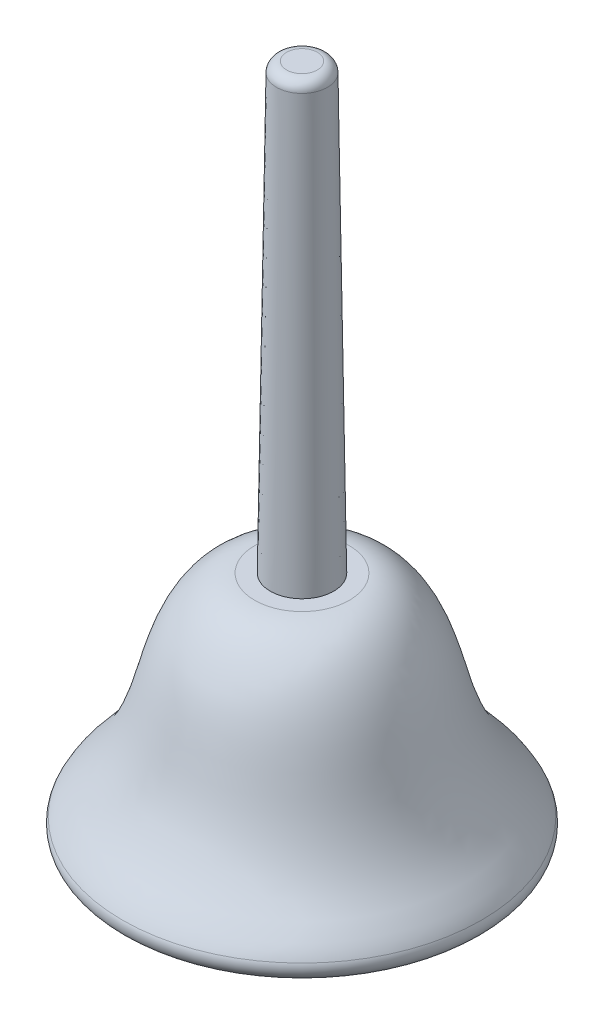
from build123d import *

# Parameters (mm, degrees)
FILLET2_R = 2.032
FILLET4_R = 1.27


with BuildPart() as part:
    # Sketch1 → Revolve3 (revolve)
    with BuildSketch(Plane.XY):
        with BuildLine():
            Line((0, 42.545), (0, 45.72))
            Line((0, 45.72), (-9.497287659, 45.72))
            add(Edge.make_bspline(
                [(-9.497287659, 45.72), (-14.213529728, 45.464495083), (-21.795325511, 37.1428909), (-24.067211816, 22.538590511), (-30.02752275, 9.539444124), (-36.734305824, 4.139328981), (-36.83, 0)],
                knots=[0, 0, 0, 0, 0.238527214, 0.556757743, 0.795415438, 1, 1, 1, 1], degree=3))
            Line((-36.83, 0), (-33.653639598, 0))
            add(Edge.make_bspline(
                [(-10.85999929, 42.277584205), (-11.579557887, 42.055449042), (-12.889359895, 41.384958345), (-14.778802224, 39.626676889), (-16.441865513, 37.264736166), (-17.79906867, 34.612984197), (-18.884774216, 31.792678406), (-20.111650288, 27.785883379), (-21.184405237, 23.485197173), (-22.580959053, 19.011290684), (-23.874304997, 15.680837948), (-25.457494611, 12.422382171), (-27.06218056, 9.819508231), (-28.552020876, 7.819472461), (-30.156998376, 5.942564016), (-31.602471782, 4.368789843), (-32.657518321, 2.935744103), (-33.216522278, 1.938481724), (-33.497206736, 1.140747737), (-33.617782772, 0.505898578), (-33.647113272, 0.167991432), (-33.653414151, 0.006074508), (-33.653639598, 0)],
                knots=[0.040915424, 0.040915424, 0.040915424, 0.040915424, 0.10085821, 0.160800996, 0.220743782, 0.280686568, 0.340629354, 0.40057214, 0.520457712, 0.580400498, 0.640343284, 0.70028607, 0.760228856, 0.790200249, 0.820171642, 0.880114428, 0.910085821, 0.940057214, 0.970028607, 0.985014303, 0.997565826, 0.998052661, 0.998052661, 0.998052661, 0.998052661], degree=3))
            add(Edge.make_bspline(
                [(-10.85999929, 42.277584205), (-9.307989135, 42.718405642), (-7.696280941, 42.545)],
                knots=[0, 0, 0, 1, 1, 1], degree=2))
            Line((-7.696280941, 42.545), (0, 42.545))
        make_face()
    revolve(axis=Axis((0, 48.006, 0), (0, -1, 0)))

    # Sketch2 → Revolve4 (revolve)
    with BuildSketch(Plane.XY):
        Polygon((0, 45.72), (-6.35, 45.72), (-5.08, 134.62), (0, 134.62), align=None)
    revolve(axis=Axis((0, 134.62, 0), (0, -1, 0)))

    # Sketch3 → Revolve5 (revolve)
    with BuildSketch(Plane.XY, mode=Mode.PRIVATE) as revolve5_sk:
        with BuildLine():
            Line((0, 45.72), (-2.54, 45.72))
            Line((-2.54, 45.72), (-2.54, 17.78))
            ThreePointArc((-2.54, 17.78), (-6.216055087, 10.66276263), (0, 5.610128867))
            Line((0, 5.610128867), (0, 17.78))
            Line((0, 17.78), (0, 45.72))
        make_face()
    revolve(revolve5_sk.sketch.rotate(Axis((0, 48.006, 0), (0, -1, 0)), 270), axis=Axis((0, 48.006, 0), (0, -1, 0)))

    # Fillet2
    fillet2_edges = [part.edges().sort_by_distance(p)[0] for p in [
        (5.08, 134.62, 0),
    ]]
    fillet(fillet2_edges, radius=FILLET2_R)

    # Fillet4
    fillet4_edges = [part.edges().sort_by_distance(p)[0] for p in [
        (33.653639598, 0, 0),
    ]]
    fillet(fillet4_edges, radius=FILLET4_R)

    # Fillet5: read off the stored shape, not the designer's step
    # Fillet5 outline → Fillet5 (revolve, cut)
    with BuildSketch(Plane.XY):
        with BuildLine():
            Line((34.755259793, 0), (36.83, 0))
            Line((36.83, 0), (36.83, 3.409782199))
            Line((36.83, 3.409782199), (35.999405724, 3.409782199))
            ThreePointArc((35.999405724, 3.409782199), (36.094045344, 1.443380248), (34.755259793, 0))
        make_face()
    revolve(axis=Axis((0, 0, 0), (0, 1, 0)), mode=Mode.SUBTRACT)


solid = part.part
